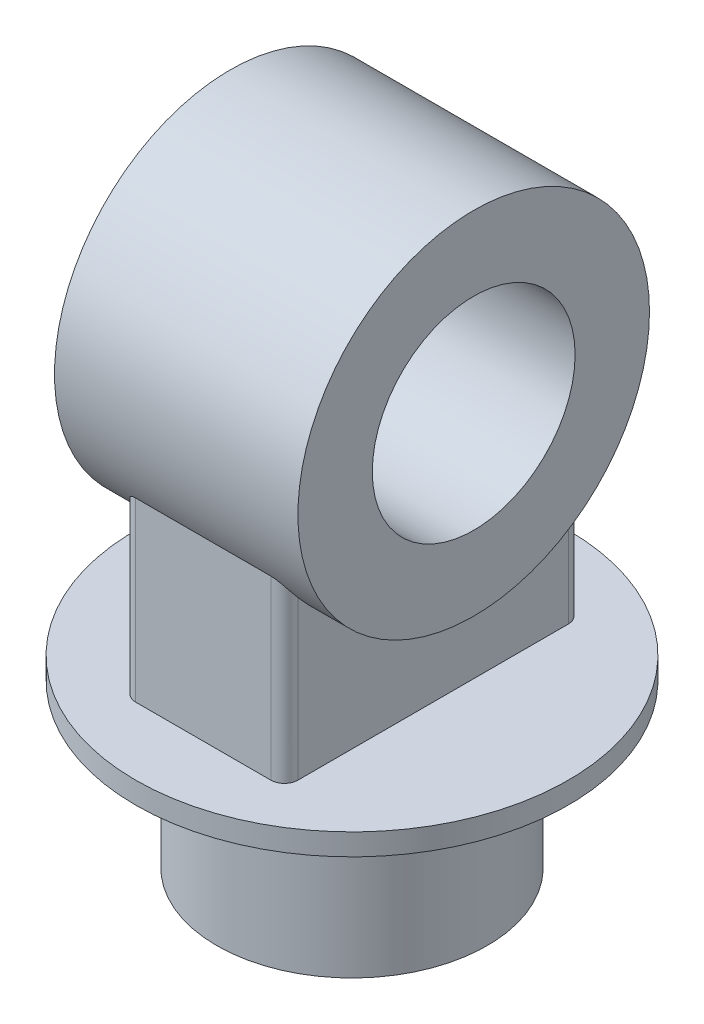
from build123d import *

# Parameters (mm, degrees)
SKETCH1_R           = 1000
BOSS_EXTRUDE1_DEPTH = 1200
SKETCH2_R           = 1600
BOSS_EXTRUDE2_DEPTH = 160
SKETCH3_R           = 1300
SKETCH3_R_2         = 750
BOSS_EXTRUDE3_DEPTH = 900
BOSS_EXTRUDE4_REACH = 4003.25
SKETCH4_W           = 1200
SKETCH4_H           = 2200
FILLET1_R           = 100


with BuildPart() as part:
    # Sketch1 → Boss-Extrude1 (new body)
    with BuildSketch(Plane(origin=(0, 0, 0), x_dir=(1, 0, 0), z_dir=(0, 1, 0))):
        Circle(SKETCH1_R)
    extrude(amount=BOSS_EXTRUDE1_DEPTH)

    # Sketch2 → Boss-Extrude2 (add)
    with BuildSketch(Plane(origin=(0, 1200, 0), x_dir=(1, 0, 0), z_dir=(0, 1, 0))):
        Circle(SKETCH2_R)
    extrude(amount=BOSS_EXTRUDE2_DEPTH)


with BuildPart() as body_2:
    # Sketch3 → Boss-Extrude3 (new, symmetric)
    with BuildSketch(Plane(origin=(0, 0, 0), x_dir=(0, 0, -1), z_dir=(1, 0, 0))):
        with Locations((0, 3360)):
            Circle(SKETCH3_R)
        with Locations((0, 3360)):
            Circle(SKETCH3_R_2, mode=Mode.SUBTRACT)
    extrude(amount=BOSS_EXTRUDE3_DEPTH, both=True)

    # Sketch4 → Boss-Extrude4 (add, up to next)
    with BuildSketch(Plane(origin=(0, 1360, 0), x_dir=(1, 0, 0), z_dir=(0, 1, 0)), mode=Mode.PRIVATE) as boss_extrude4_sk1:
        Rectangle(SKETCH4_W, SKETCH4_H)
    boss_extrude4_tool1 = extrude(boss_extrude4_sk1.sketch, amount=BOSS_EXTRUDE4_REACH, mode=Mode.PRIVATE) - body_2.part

    add(part.part)  # Boss-Extrude4 merges part
    add(boss_extrude4_tool1.solids().sort_by_distance((0, 1360, 0))[0])

    # Fillet1
    fillet1_edges = [body_2.edges().sort_by_distance(p)[0] for p in [
        (-600, 2013.589838486, 1100),
        (600, 2013.589838486, 1100),
        (600, 2013.589838486, -1100),
        (-600, 2013.589838486, -1100),
    ]]
    fillet(fillet1_edges, radius=FILLET1_R)


solid = body_2.part
